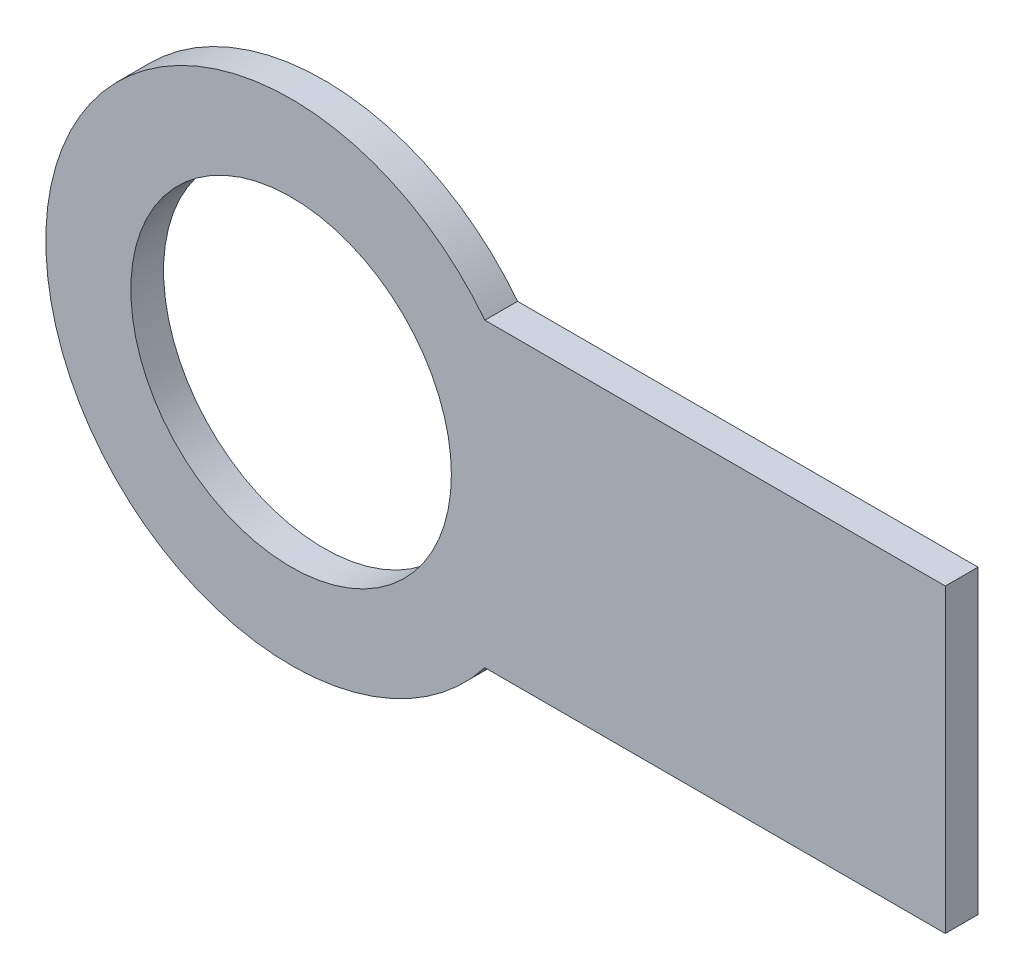
from build123d import *

# Parameters (mm, degrees)
BODY_SKETCH_R      = 2.45
BASE_FLANGE1_DEPTH = 0.5


# Sheet-metal steps are written as plain solids
with BuildPart() as part:
    # Body Sketch → Base-Flange1 (new body)
    with BuildSketch(Plane.XY):
        with BuildLine():
            Line((2.961840644, 2.3), (10, 2.3))
            Line((10, 2.3), (10, -2.3))
            Line((10, -2.3), (2.961840644, -2.3))
            ThreePointArc((2.961840644, -2.3), (-3.75, 0), (2.961840644, 2.3))
        make_face()
        Circle(BODY_SKETCH_R, mode=Mode.SUBTRACT)
    extrude(amount=-BASE_FLANGE1_DEPTH)


solid = part.part
